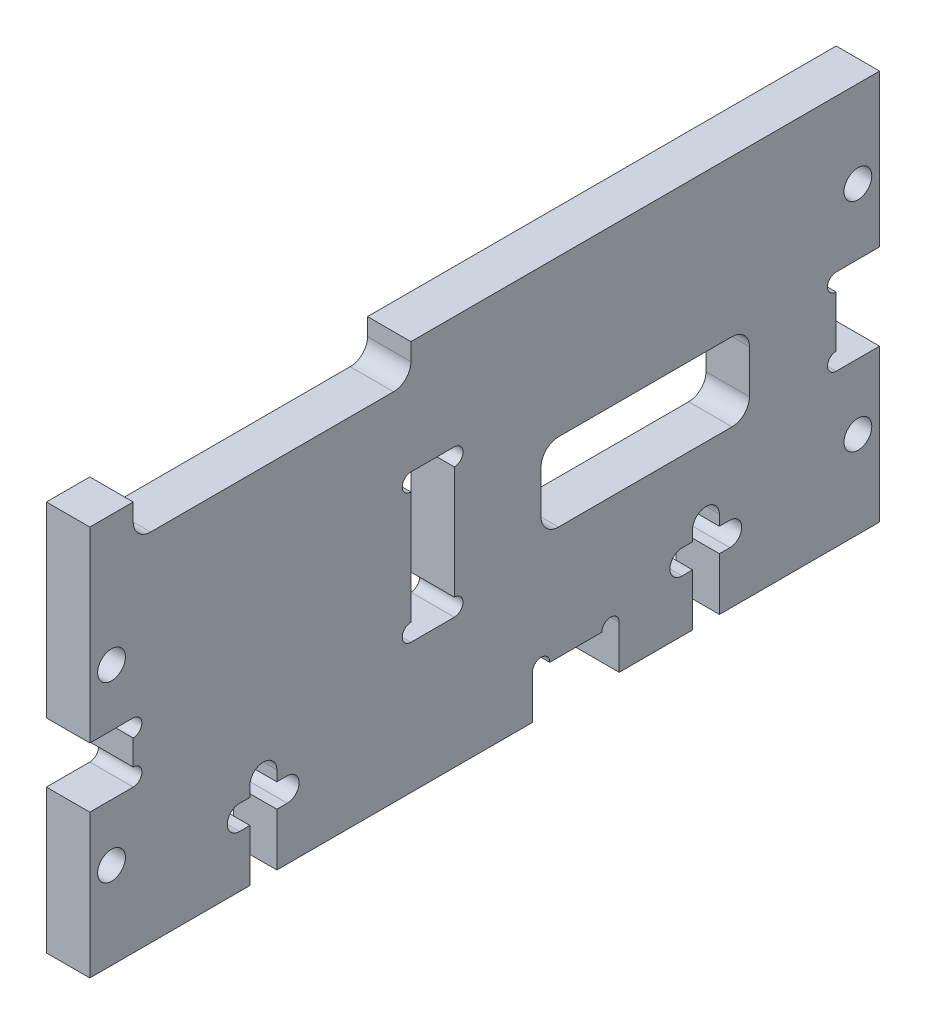
from build123d import *

# Parameters (mm, degrees)
SKETCH_1_W           = 91
SKETCH_1_H           = 45
EXTRUDE_1_DEPTH      = 5
SKETCH_7_W           = 24
SKETCH_7_H           = 9
CUT_EXTRUDE_3_DEPTH  = 10
FILLET_1_R           = 2
SKETCH_8_W           = 32
SKETCH_8_H           = 4
CUT_EXTRUDE_4_DEPTH  = 10
FILLET_2_R           = 2
SKETCH_9_W           = 5
SKETCH_9_H           = 17
CUT_EXTRUDE_5_DEPTH  = 5
SKETCH_14_R          = 1.55
SKETCH_14_R_2        = 1.482519405
CUT_EXTRUDE_9_DEPTH  = 10
SKETCH_10_R          = 1
CUT_EXTRUDE_6_DEPTH  = 10
SKETCH_12_R          = 1.6
CUT_EXTRUDE_7_DEPTH  = 10
CUT_EXTRUDE_8_DEPTH  = 10
SKETCH_15_W          = 10
SKETCH_15_H          = 5
CUT_EXTRUDE_10_DEPTH = 10
SKETCH_19_W          = 5
SKETCH_19_H          = 6.9
SKETCH_19_H_2        = 9.9
CUT_EXTRUDE_14_DEPTH = 5
SKETCH_16_R          = 1
CUT_EXTRUDE_11_DEPTH = 10


with BuildPart() as part:
    # 스케치1 → 보스-돌출1 (new body)
    with BuildSketch(Plane(origin=(0, 0, 0), x_dir=(0, 0, -1), z_dir=(1, 0, 0))):
        with Locations((45.5, 22.5)):
            Rectangle(SKETCH_1_W, SKETCH_1_H)
    extrude(amount=EXTRUDE_1_DEPTH)

    # 스케치7 → 컷-돌출3 (cut)
    with BuildSketch(Plane(origin=(5, 0, 0), x_dir=(0, 0, -1), z_dir=(1, 0, 0))):
        with Locations((64, 22.5)):
            Rectangle(SKETCH_7_W, SKETCH_7_H)
    extrude(amount=-CUT_EXTRUDE_3_DEPTH, mode=Mode.SUBTRACT)

    # 필렛1
    fillet_1_edges = [part.edges().sort_by_distance(p)[0] for p in [
        (2.5, 18, -52),
        (2.5, 18, -76),
        (2.5, 27, -76),
        (2.5, 27, -52),
    ]]
    fillet(fillet_1_edges, radius=FILLET_1_R)

    # 스케치8 → 컷-돌출4 (cut)
    with BuildSketch(Plane(origin=(5, 0, 0), x_dir=(0, 0, -1), z_dir=(1, 0, 0))):
        with Locations((21, 43)):
            Rectangle(SKETCH_8_W, SKETCH_8_H)
    extrude(amount=-CUT_EXTRUDE_4_DEPTH, mode=Mode.SUBTRACT)

    # 필렛2
    fillet_2_edges = [part.edges().sort_by_distance(p)[0] for p in [
        (2.5, 41, -37),
        (2.5, 41, -5),
    ]]
    fillet(fillet_2_edges, radius=FILLET_2_R)

    # 스케치9 → 컷-돌출5 (cut)
    with BuildSketch(Plane.ZY):
        with Locations((-39.5, 23.5)):
            Rectangle(SKETCH_9_W, SKETCH_9_H)
    extrude(amount=-CUT_EXTRUDE_5_DEPTH, mode=Mode.SUBTRACT)

    # 스케치14 → 컷-돌출9 (cut)
    with BuildSketch(Plane(origin=(5, 0, 0), x_dir=(0, 0, -1), z_dir=(1, 0, 0))):
        with Locations((2.5, 10)):
            Circle(SKETCH_14_R)
        with Locations((2.5, 30)):
            Circle(SKETCH_14_R)
        with Locations((88.5, 35.067480595)):
            Circle(SKETCH_14_R_2)
        with Locations((88.5, 10)):
            Circle(SKETCH_14_R)
    extrude(amount=-CUT_EXTRUDE_9_DEPTH, mode=Mode.SUBTRACT)

    # 스케치10 → 컷-돌출6 (cut)
    with BuildSketch(Plane(origin=(5, 0, 0), x_dir=(0, 0, -1), z_dir=(1, 0, 0))):
        with Locations((42, 31)):
            Circle(SKETCH_10_R)
        with Locations((42, 16)):
            Circle(SKETCH_10_R)
        with Locations((37, 16)):
            Circle(SKETCH_10_R)
        with Locations((37, 31)):
            Circle(SKETCH_10_R)
    extrude(amount=-CUT_EXTRUDE_6_DEPTH, mode=Mode.SUBTRACT)

    # 스케치12 → 컷-돌출7 (cut)
    with BuildSketch(Plane(origin=(5, 0, 0), x_dir=(0, 0, -1), z_dir=(1, 0, 0))):
        with Locations((2.5, 30)):
            Circle(SKETCH_12_R)
        with Locations((2.5, 10)):
            Circle(SKETCH_12_R)
        with Locations((88.5, 35)):
            Circle(SKETCH_12_R)
        with Locations((88.5, 10)):
            Circle(SKETCH_12_R)
    extrude(amount=-CUT_EXTRUDE_7_DEPTH, mode=Mode.SUBTRACT)

    # 스케치13 → 컷-돌출8 (cut)
    with BuildSketch(Plane(origin=(5, 0, 0), x_dir=(0, 0, -1), z_dir=(1, 0, 0))):
        with BuildLine():
            Line((18.45, 0), (18.45, 6))
            Line((18.45, 6), (17.250192706, 6))
            ThreePointArc((17.250192706, 6), (15.841386702, 7.391138254), (17.232524956, 8.799944258))
            Line((17.232524956, 8.799944258), (18.45, 8.799944258))
            Line((18.45, 8.799944258), (18.45, 10))
            ThreePointArc((18.45, 10), (20, 11.55), (21.55, 10))
            Line((21.55, 10), (21.55, 8.799872773))
            Line((21.55, 8.799872773), (22.749807294, 8.799872773))
            ThreePointArc((22.749807294, 8.799872773), (24.117188413, 7.432491654), (22.749807294, 6.065110535))
            Line((22.749807294, 6.065110535), (21.55, 6.065110535))
            Line((21.55, 6.065110535), (21.55, 0))
            Line((21.55, 0), (18.45, 0))
        make_face()
        with BuildLine():
            Line((72.55, 0), (72.55, 6.065110535))
            Line((72.55, 6.065110535), (73.749807294, 6.065110535))
            ThreePointArc((73.749807294, 6.065110535), (75.117188413, 7.432491654), (73.749807294, 8.799872773))
            Line((73.749807294, 8.799872773), (72.55, 8.799872773))
            Line((72.55, 8.799872773), (72.55, 10))
            ThreePointArc((72.55, 10), (71, 11.55), (69.45, 10))
            Line((69.45, 10), (69.45, 8.799944258))
            Line((69.45, 8.799944258), (68.232524956, 8.799944258))
            ThreePointArc((68.232524956, 8.799944258), (66.841386702, 7.391138254), (68.250192706, 6))
            Line((68.250192706, 6), (69.45, 6))
            Line((69.45, 6), (69.45, 0))
            Line((69.45, 0), (72.55, 0))
        make_face()
    extrude(amount=-CUT_EXTRUDE_8_DEPTH, mode=Mode.SUBTRACT)

    # 스케치15 → 컷-돌출10 (cut)
    with BuildSketch(Plane(origin=(5, 0, 0), x_dir=(0, 0, -1), z_dir=(1, 0, 0))):
        with Locations((56, 2.5)):
            Rectangle(SKETCH_15_W, SKETCH_15_H)
    extrude(amount=-CUT_EXTRUDE_10_DEPTH, mode=Mode.SUBTRACT)

    # 스케치19 → 컷-돌출14 (cut)
    with BuildSketch(Plane.ZY):
        with Locations((-2.5, 20)):
            Rectangle(SKETCH_19_W, SKETCH_19_H)
        with Locations((-88.5, 22.5)):
            Rectangle(SKETCH_19_W, SKETCH_19_H_2)
    extrude(amount=-CUT_EXTRUDE_14_DEPTH, mode=Mode.SUBTRACT)

    # 스케치16 → 컷-돌출11 (cut)
    with BuildSketch(Plane.ZY):
        with Locations((-60, 5)):
            Circle(SKETCH_16_R)
        with Locations((-52, 5)):
            Circle(SKETCH_16_R)
        with Locations((-86, 26.45)):
            Circle(SKETCH_16_R)
        with Locations((-86, 18.55)):
            Circle(SKETCH_16_R)
        with Locations((-5, 22.45)):
            Circle(SKETCH_16_R)
        with Locations((-5, 17.55)):
            Circle(SKETCH_16_R)
    extrude(amount=-CUT_EXTRUDE_11_DEPTH, mode=Mode.SUBTRACT)


solid = part.part
